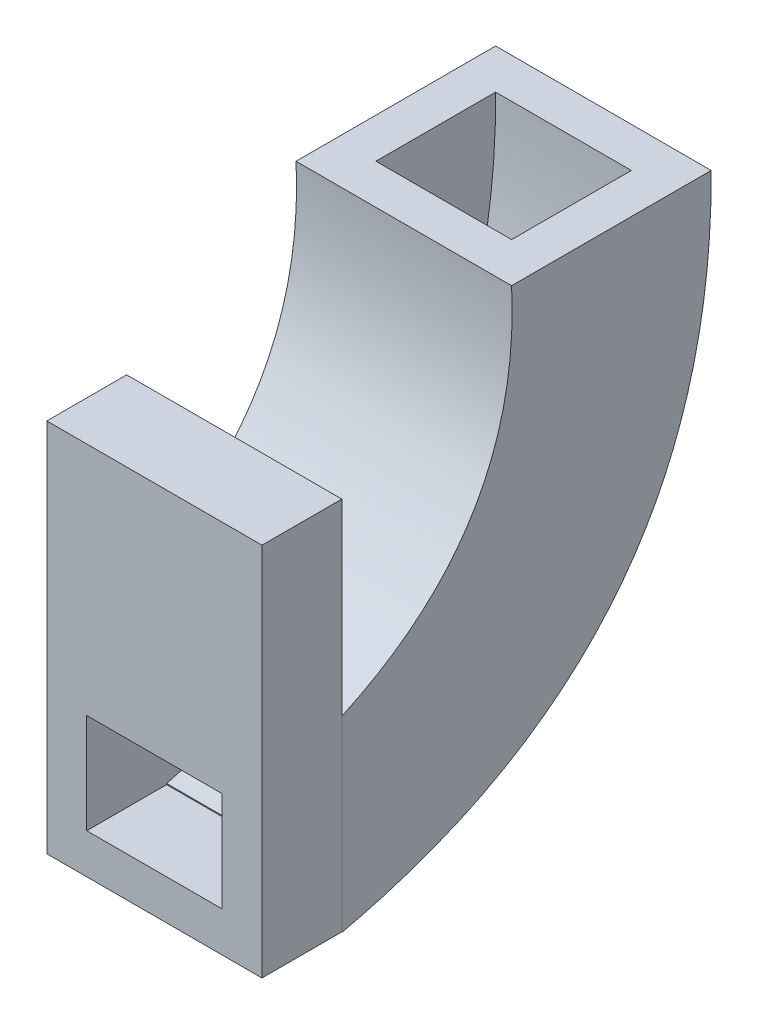
from build123d import *

# Parameters (mm, degrees)
SKETCH1_W           = 26.95
SKETCH1_H           = 46.95
BOSS_EXTRUDE1_DEPTH = 10
BOSS_EXTRUDE2_DEPTH = 27
SHELL8_START        = -19.600513699
SHELL8_DEPTH        = 16.95
SHELL8_START_2      = -2.650513699
SHELL8_2_DEPTH      = 0.05
SKETCH2_W           = 16.95
SKETCH2_H           = 12.5
CUT_EXTRUDE4_DEPTH  = 10


with BuildPart() as part:
    # Sketch1 → Boss-Extrude1 (new body)
    with BuildSketch(Plane.XY):
        with Locations((-11.125513699, 7.918792808)):
            Rectangle(SKETCH1_W, SKETCH1_H)
    extrude(amount=BOSS_EXTRUDE1_DEPTH)

    # Sketch4 → Boss-Extrude2 (add)
    with BuildSketch(Plane.ZY.offset(24.600513699)):
        with BuildLine():
            Line((-46.212773115, 43.956542828), (-21.212773115, 43.956542828))
            add(Edge.make_bspline(
                [(-21.212773115, 43.956542828), (-22.507146557, 18.214325733), (0, 7.918792808)],
                knots=[0, 0, 0, 1, 1, 1], degree=2))
            Line((0, 7.918792808), (0, -15.556207192))
            add(Edge.make_bspline(
                [(0, -15.556207192), (-46.51884588, -5.084322465), (-46.212773115, 43.956542828)],
                knots=[0, 0, 0, 1, 1, 1], degree=2))
        make_face()
    extrude(amount=-BOSS_EXTRUDE2_DEPTH)

    # Shell8: read off the stored shape, not the designer's step
    # Shell8 outline → Shell8 (cut)
    with BuildSketch(Plane.YZ.offset(SHELL8_START)):
        with BuildLine():
            add(Edge.make_bspline(
                [(0.133337383, 5), (0.345681756, 4.535792266), (0.558026134, 4.071584534), (0.983328432, 3.141827798), (1.196286353, 2.676278794), (1.515939617, 1.977482236), (1.622634963, 1.744234684), (1.836025783, 1.277739332), (1.942721258, 1.044491531), (2.156238437, 0.577719852), (2.263060141, 0.344195974), (2.476703299, -0.122850765), (2.583524752, -0.356373626), (2.743774073, -0.7066967), (2.797202188, -0.823496798), (2.90405926, -1.057096448), (2.957488218, -1.173896), (3.064343405, -1.40749826), (3.117769635, -1.524300968), (3.224635192, -1.757900928), (3.278074521, -1.874698178), (3.358690558, -2.050988982), (3.385885066, -2.110474317), (3.440500257, -2.229341011), (3.467920939, -2.28872237), (3.522966477, -2.4073897), (3.550591329, -2.466675672), (3.606052478, -2.585148793), (3.633888775, -2.644335942), (3.717712007, -2.821743977), (3.774015221, -2.939815627), (3.887473761, -3.175549982), (3.944629094, -3.293212682), (4.059722281, -3.527962081), (4.117659001, -3.645049336), (4.234395499, -3.878791899), (4.293195274, -3.995447208), (4.470904183, -4.344756863), (4.591119744, -4.576748487), (4.746963204, -4.871943256), (4.780959441, -4.936008122), (4.815092457, -5)],
                knots=[0, 0, 0, 0, 1.531408038, 1.531408038, 3.067240894, 3.067240894, 3.836717895, 3.836717895, 4.606195736, 4.606195736, 5.376584277, 5.376584277, 6.146969731, 6.146969731, 6.532289645, 6.532289645, 6.91760913, 6.91760913, 7.302933783, 7.302933783, 7.688260043, 7.688260043, 7.884480209, 7.884480209, 8.080699876, 8.080699876, 8.276917809, 8.276917809, 8.473136224, 8.473136224, 8.865559231, 8.865559231, 9.257985754, 9.257985754, 9.649893747, 9.649893747, 10.041800114, 10.041800114, 10.825634375, 10.825634375, 11.043210189, 11.043210189, 11.043210189, 11.043210189], degree=3))
            Line((0.133337383, 5), (-10.556207192, 5))
            Line((-10.556207192, 5), (-10.556207192, 0.563474302))
            add(Edge.make_bspline(
                [(-9.064978411, -4.999999991), (-9.156570125, -4.701885385), (-9.24631398, -4.403203161), (-9.561269931, -3.331553183), (-9.77625048, -2.555588985), (-10.183066223, -0.9993865), (-10.374950059, -0.219160945), (-10.556207192, 0.563474302)],
                knots=[69.771004898, 69.771004898, 69.771004898, 69.771004898, 70.706566593, 70.706566593, 73.121797433, 73.121797433, 75.531849504, 75.531849504, 75.531849504, 75.531849504], degree=3))
            Line((-9.064978411, -4.999999991), (4.815092457, -5))
        make_face()
        with BuildLine():
            add(Edge.make_bspline(
                [(4.815092457, -5), (4.903802589, -5.16631194), (4.993436598, -5.332130884), (5.209418135, -5.726348117), (5.336622424, -5.95427718), (5.594591961, -6.407949193), (5.725355246, -6.633693259), (5.990554029, -7.083012804), (6.124989536, -7.306588277), (6.533877125, -7.973910646), (6.813909864, -8.414252757), (7.501769623, -9.45538102), (7.916708251, -10.051491595), (8.776915799, -11.222231728), (9.222210647, -11.796842257), (10.14315243, -12.921459213), (10.618805958, -13.471460251), (11.596271939, -14.539674082), (12.097844547, -15.05810607), (13.129821164, -16.06512428), (13.660215755, -16.553720139), (14.748839143, -17.498721573), (15.307064076, -17.955131594), (16.452632219, -18.835753352), (17.040102002, -19.259800533), (18.239831396, -20.071505643), (18.852095715, -20.459156614), (20.099010065, -21.196614321), (20.733660392, -21.546420557), (22.027410025, -22.209707809), (22.686652036, -22.522910303), (24.02247808, -23.109745158), (24.699061762, -23.383378322), (26.06673068, -23.891282927), (26.757814216, -24.125558955), (28.122867732, -24.546564943), (28.796354803, -24.734866604), (30.152177572, -25.077042106), (30.834515492, -25.23090712), (32.20623315, -25.505495974), (32.89561695, -25.626199435), (34.27960354, -25.835879011), (34.974209302, -25.9248354), (36.359066573, -26.071729163), (37.049283903, -26.129991675), (38.431219698, -26.218560515), (39.122937475, -26.248877708), (40.50608531, -26.283225615), (41.197514548, -26.287290879), (42.578339573, -26.270865345), (43.267736076, -26.250436697), (43.956542828, -26.218584564)],
                knots=[11.043210189, 11.043210189, 11.043210189, 11.043210189, 11.608679687, 11.608679687, 12.39171379, 12.39171379, 13.17432443, 13.17432443, 13.956936752, 13.956936752, 15.522163921, 15.522163921, 17.700153688, 17.700153688, 19.880027691, 19.880027691, 22.060376756, 22.060376756, 24.223274542, 24.223274542, 26.385469858, 26.385469858, 28.547365884, 28.547365884, 30.719608792, 30.719608792, 32.892266153, 32.892266153, 35.06495227, 35.06495227, 37.253221206, 37.253221206, 39.4414458, 39.4414458, 41.629415114, 41.629415114, 43.726426105, 43.726426105, 45.823973995, 45.823973995, 47.922808087, 47.922808087, 50.022944109, 50.022944109, 52.100361974, 52.100361974, 54.176971764, 54.176971764, 56.250847899, 56.250847899, 58.319472882, 58.319472882, 58.319472882, 58.319472882], degree=3))
            Line((4.815092457, -5), (-9.064978411, -4.999999991))
            add(Edge.make_bspline(
                [(43.956542828, -41.212675735), (43.08159333, -41.218387139), (42.206510767, -41.212470025), (40.452472812, -41.175466896), (39.573520137, -41.144254146), (37.81409322, -41.05450592), (36.933623442, -40.995881178), (35.173557367, -40.849113982), (34.293965366, -40.760919539), (32.538042346, -40.552823313), (31.661713288, -40.432904863), (29.899770644, -40.156829312), (29.014245887, -40.000101308), (27.251562235, -39.649281799), (26.374395484, -39.455229981), (24.630942511, -39.02748594), (23.764643629, -38.793845568), (22.045439839, -38.284683982), (21.192521132, -38.009209545), (19.502563594, -37.414184785), (18.66551781, -37.094654292), (17.080744635, -36.438781556), (16.331472067, -36.106175889), (14.851543336, -35.401485138), (14.120890004, -35.029394096), (12.681301321, -34.245280752), (11.972365934, -33.833258519), (10.585013137, -32.972971721), (9.906390037, -32.525039184), (8.576171468, -31.59065667), (7.924576288, -31.104206282), (6.6509416, -30.094123435), (6.028900056, -29.570493545), (4.816011624, -28.4875535), (4.22518422, -27.92822153), (3.076653554, -26.77647648), (2.518952412, -26.184061288), (1.437715478, -24.968886679), (0.914179031, -24.346127843), (-0.102171007, -23.068298687), (-0.59472033, -22.413018454), (-1.544810043, -21.077595755), (-2.002350454, -20.397453304), (-2.882958603, -19.015301999), (-3.306028267, -18.313294369), (-4.117827977, -16.891618757), (-4.506625676, -16.171989322), (-5.252096056, -14.716148432), (-5.608762794, -13.979933942), (-6.291436173, -12.493001824), (-6.617427028, -11.742276968), (-7.240180735, -10.228384956), (-7.536928694, -9.46521169), (-8.098270292, -7.940224914), (-8.363281633, -7.178564727), (-8.770075995, -5.943328274), (-8.919846996, -5.472376719), (-9.064978411, -4.999999991)],
                knots=[0, 0, 0, 0, 2.624912237, 2.624912237, 5.263057644, 5.263057644, 7.909854609, 7.909854609, 10.561329771, 10.561329771, 13.214200731, 13.214200731, 15.911305703, 15.911305703, 18.605558456, 18.605558456, 21.296309343, 21.296309343, 23.984073444, 23.984073444, 26.670631688, 26.670631688, 29.128871448, 29.128871448, 31.587482756, 31.587482756, 34.04608988, 34.04608988, 36.484129019, 36.484129019, 38.922194168, 38.922194168, 41.360090952, 41.360090952, 43.799491796, 43.799491796, 46.239048551, 46.239048551, 48.678558649, 48.678558649, 51.136642725, 51.136642725, 53.594725264, 53.594725264, 56.05267039, 56.05267039, 58.505649358, 58.505649358, 60.95908098, 60.95908098, 63.413768252, 63.413768252, 65.869699113, 65.869699113, 68.288563026, 68.288563026, 69.771004898, 69.771004898, 69.771004898, 69.771004898], degree=3))
            Line((43.956542828, -41.212675735), (43.956542828, -26.218584564))
        make_face()
    extrude(amount=SHELL8_DEPTH, mode=Mode.SUBTRACT)

    # Shell8 2 outline → Shell8 2 (cut)
    with BuildSketch(Plane.YZ.offset(SHELL8_START_2)):
        with BuildLine():
            add(Edge.make_bspline(
                [(4.815092457, -5), (4.903802589, -5.16631194), (4.993436598, -5.332130884), (5.209418135, -5.726348117), (5.336622424, -5.95427718), (5.594591961, -6.407949193), (5.725355246, -6.633693259), (5.990554029, -7.083012804), (6.124989536, -7.306588277), (6.533877125, -7.973910646), (6.813909864, -8.414252757), (7.501769623, -9.45538102), (7.916708251, -10.051491595), (8.776915799, -11.222231728), (9.222210647, -11.796842257), (10.14315243, -12.921459213), (10.618805958, -13.471460251), (11.596271939, -14.539674082), (12.097844547, -15.05810607), (13.129821164, -16.06512428), (13.660215755, -16.553720139), (14.748839143, -17.498721573), (15.307064076, -17.955131594), (16.452632219, -18.835753352), (17.040102002, -19.259800533), (18.239831396, -20.071505643), (18.852095715, -20.459156614), (20.099010065, -21.196614321), (20.733660392, -21.546420557), (22.027410025, -22.209707809), (22.686652036, -22.522910303), (24.02247808, -23.109745158), (24.699061762, -23.383378322), (26.06673068, -23.891282927), (26.757814216, -24.125558955), (28.122867732, -24.546564943), (28.796354803, -24.734866604), (30.152177572, -25.077042106), (30.834515492, -25.23090712), (32.20623315, -25.505495974), (32.89561695, -25.626199435), (34.27960354, -25.835879011), (34.974209302, -25.9248354), (36.359066573, -26.071729163), (37.049283903, -26.129991675), (38.431219698, -26.218560515), (39.122937475, -26.248877708), (40.50608531, -26.283225615), (41.197514548, -26.287290879), (42.578339573, -26.270865345), (43.267736076, -26.250436697), (43.956542828, -26.218584564)],
                knots=[11.043210189, 11.043210189, 11.043210189, 11.043210189, 11.608679687, 11.608679687, 12.39171379, 12.39171379, 13.17432443, 13.17432443, 13.956936752, 13.956936752, 15.522163921, 15.522163921, 17.700153688, 17.700153688, 19.880027691, 19.880027691, 22.060376756, 22.060376756, 24.223274542, 24.223274542, 26.385469858, 26.385469858, 28.547365884, 28.547365884, 30.719608792, 30.719608792, 32.892266153, 32.892266153, 35.06495227, 35.06495227, 37.253221206, 37.253221206, 39.4414458, 39.4414458, 41.629415114, 41.629415114, 43.726426105, 43.726426105, 45.823973995, 45.823973995, 47.922808087, 47.922808087, 50.022944109, 50.022944109, 52.100361974, 52.100361974, 54.176971764, 54.176971764, 56.250847899, 56.250847899, 58.319472882, 58.319472882, 58.319472882, 58.319472882], degree=3))
            Line((4.815092457, -5), (-9.064978411, -4.999999991))
            add(Edge.make_bspline(
                [(43.956542828, -41.212675735), (43.08159333, -41.218387139), (42.206510767, -41.212470025), (40.452472812, -41.175466896), (39.573520137, -41.144254146), (37.81409322, -41.05450592), (36.933623442, -40.995881178), (35.173557367, -40.849113982), (34.293965366, -40.760919539), (32.538042346, -40.552823313), (31.661713288, -40.432904863), (29.899770644, -40.156829312), (29.014245887, -40.000101308), (27.251562235, -39.649281799), (26.374395484, -39.455229981), (24.630942511, -39.02748594), (23.764643629, -38.793845568), (22.045439839, -38.284683982), (21.192521132, -38.009209545), (19.502563594, -37.414184785), (18.66551781, -37.094654292), (17.080744635, -36.438781556), (16.331472067, -36.106175889), (14.851543336, -35.401485138), (14.120890004, -35.029394096), (12.681301321, -34.245280752), (11.972365934, -33.833258519), (10.585013137, -32.972971721), (9.906390037, -32.525039184), (8.576171468, -31.59065667), (7.924576288, -31.104206282), (6.6509416, -30.094123435), (6.028900056, -29.570493545), (4.816011624, -28.4875535), (4.22518422, -27.92822153), (3.076653554, -26.77647648), (2.518952412, -26.184061288), (1.437715478, -24.968886679), (0.914179031, -24.346127843), (-0.102171007, -23.068298687), (-0.59472033, -22.413018454), (-1.544810043, -21.077595755), (-2.002350454, -20.397453304), (-2.882958603, -19.015301999), (-3.306028267, -18.313294369), (-4.117827977, -16.891618757), (-4.506625676, -16.171989322), (-5.252096056, -14.716148432), (-5.608762794, -13.979933942), (-6.291436173, -12.493001824), (-6.617427028, -11.742276968), (-7.240180735, -10.228384956), (-7.536928694, -9.46521169), (-8.098270292, -7.940224914), (-8.363281633, -7.178564727), (-8.770075995, -5.943328274), (-8.919846996, -5.472376719), (-9.064978411, -4.999999991)],
                knots=[0, 0, 0, 0, 2.624912237, 2.624912237, 5.263057644, 5.263057644, 7.909854609, 7.909854609, 10.561329771, 10.561329771, 13.214200731, 13.214200731, 15.911305703, 15.911305703, 18.605558456, 18.605558456, 21.296309343, 21.296309343, 23.984073444, 23.984073444, 26.670631688, 26.670631688, 29.128871448, 29.128871448, 31.587482756, 31.587482756, 34.04608988, 34.04608988, 36.484129019, 36.484129019, 38.922194168, 38.922194168, 41.360090952, 41.360090952, 43.799491796, 43.799491796, 46.239048551, 46.239048551, 48.678558649, 48.678558649, 51.136642725, 51.136642725, 53.594725264, 53.594725264, 56.05267039, 56.05267039, 58.505649358, 58.505649358, 60.95908098, 60.95908098, 63.413768252, 63.413768252, 65.869699113, 65.869699113, 68.288563026, 68.288563026, 69.771004898, 69.771004898, 69.771004898, 69.771004898], degree=3))
            Line((43.956542828, -41.212675735), (43.956542828, -26.218584564))
        make_face()
    extrude(amount=SHELL8_2_DEPTH, mode=Mode.SUBTRACT)

    # Sketch2 → Cut-Extrude4 (cut)
    with BuildSketch(Plane.XY.offset(10)):
        with Locations((-11.125513699, -4.306207192)):
            Rectangle(SKETCH2_W, SKETCH2_H)
    extrude(amount=-CUT_EXTRUDE4_DEPTH, mode=Mode.SUBTRACT)


solid = part.part
